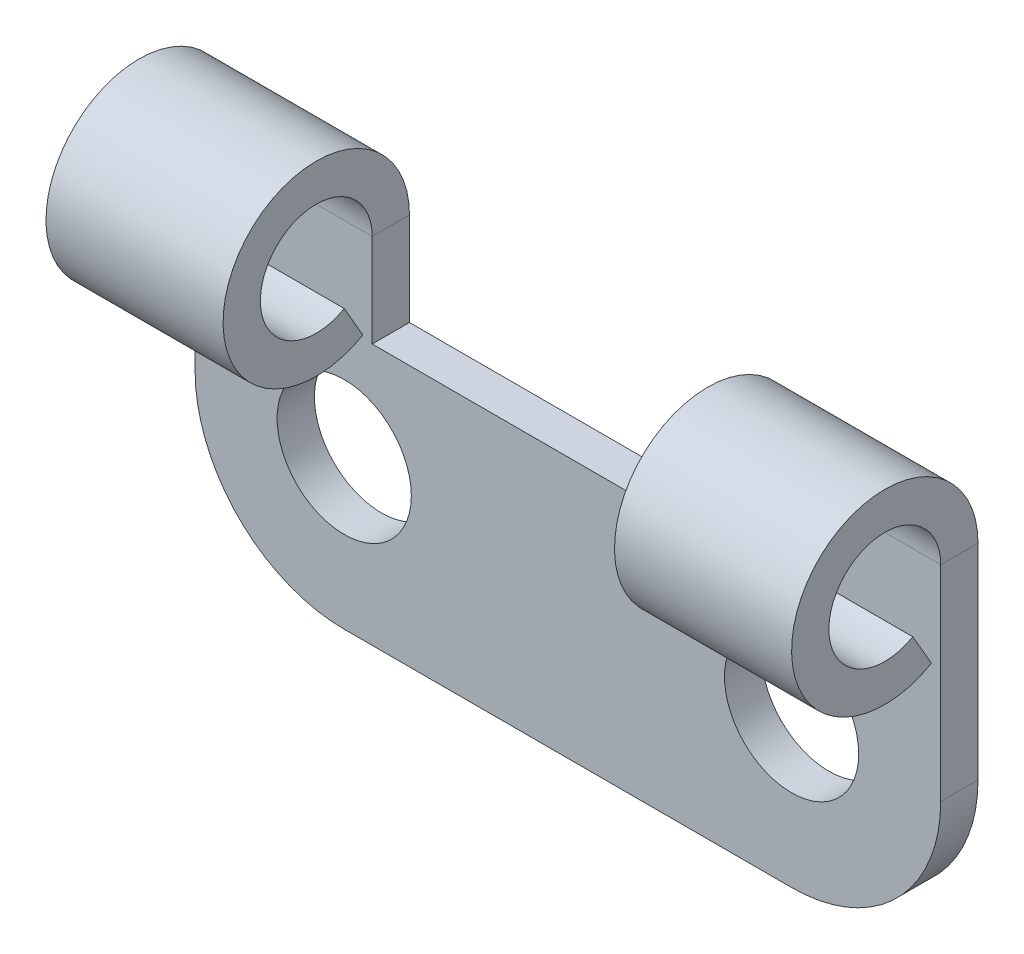
from build123d import *

# Parameters (mm, degrees)
SM_BASE_FLANGE_1_DEPTH = 1
OTHER_START            = -10
OTHER_1_DEPTH          = 20
OTHER_1_2_DEPTH        = 4.75
OTHER_START_2          = 5.25
OTHER_1_3_DEPTH        = 4.75
FILLET_1_R             = 4
HOLE_WIZARD_M31_D      = 3.6


# Read off the part's stored shape, not the designer's step: Каемка1
# Sheet-metal steps are written as plain solids
with BuildPart() as part:
    # Sketch 1 → Базовая кромка1 (new body)
    with BuildSketch(Plane.XY):
        Polygon((5.25, 6), (5.25, 1), (-5.25, 1), (-5.25, 6), (-10, 6), (-10, -6), (10, -6), (10, 6), align=None)
    extrude(amount=-SM_BASE_FLANGE_1_DEPTH)

    # Other 1 outline → Other 1 (cut)
    with BuildSketch(Plane.YZ.offset(OTHER_START)):
        with BuildLine():
            Line((6, 0), (5.5, 0))
            ThreePointArc((5.5, 0), (4.618033989, -0.736067978), (3.5, -1))
            Line((3.5, -1), (6, -1))
            Line((6, -1), (6, 0))
        make_face()
    extrude(amount=OTHER_1_DEPTH, mode=Mode.SUBTRACT)

    # Other 1 2 outline → Other 1 2 (add)
    with BuildSketch(Plane.YZ.offset(OTHER_START)):
        with BuildLine():
            Line((1.334936491, 0.25), (2.200961894, 0.75))
            ThreePointArc((2.200961894, 0.75), (4.25, 2.799038106), (3.5, 0))
            Line((3.5, 0), (5.5, 0))
            ThreePointArc((5.5, 0), (3.649788152, 3.995508667), (1.334936491, 0.25))
        make_face()
    extrude(amount=OTHER_1_2_DEPTH)

    # Other 1 3 outline → Other 1 3 (add)
    with BuildSketch(Plane.YZ.offset(OTHER_START_2)):
        with BuildLine():
            Line((1.334936491, 0.25), (2.200961894, 0.75))
            ThreePointArc((2.200961894, 0.75), (4.25, 2.799038106), (3.5, 0))
            Line((3.5, 0), (5.5, 0))
            ThreePointArc((5.5, 0), (3.649788152, 3.995508667), (1.334936491, 0.25))
        make_face()
    extrude(amount=OTHER_1_3_DEPTH)

    # Скругление1
    fillet_1_edges = [part.edges().sort_by_distance(p)[0] for p in [
        (10, -6, -0.5),
        (-10, -6, -0.5),
    ]]
    fillet(fillet_1_edges, radius=FILLET_1_R)

    # Отверстие с зазором M31 (through all)
    with Locations(Plane.XY):
        with Locations((6, -2), (-6, -2)):
            Hole(HOLE_WIZARD_M31_D / 2)


solid = part.part
